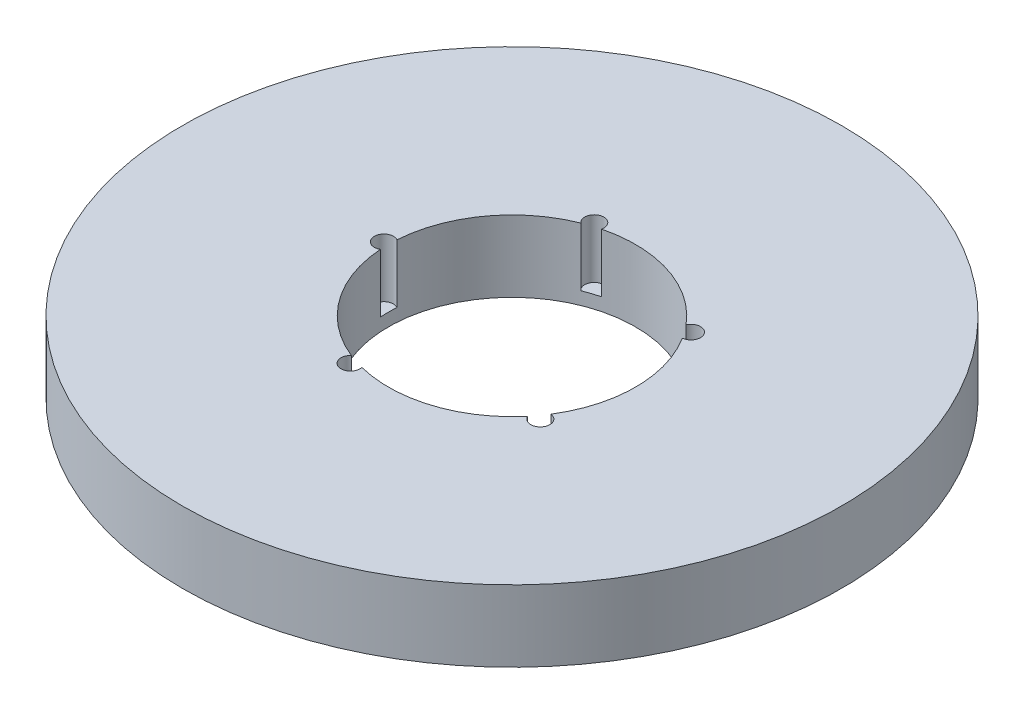
from build123d import *

# Parameters (mm, degrees)
SKETCH1_R           = 60
BOSS_EXTRUDE1_DEPTH = 13
SKETCH2_R           = 22.5
CUT_EXTRUDE1_DEPTH  = 86.842879728
SKETCH3_R           = 1.742539197
CUT_EXTRUDE2_DEPTH  = 10.675480617
CIRPATTERN1_COUNT   = 5


with BuildPart() as part:
    # Sketch1 → Boss-Extrude1 (new body)
    with BuildSketch(Plane(origin=(0, 0, 0), x_dir=(1, 0, 0), z_dir=(0, 1, 0))):
        Circle(SKETCH1_R)
    extrude(amount=BOSS_EXTRUDE1_DEPTH)

    # Sketch2 → Cut-Extrude1 (cut, through all)
    with BuildSketch(Plane(origin=(0, 0, 0), x_dir=(1, 0, 0), z_dir=(0, 1, 0))):
        Circle(SKETCH2_R)
    extrude(amount=CUT_EXTRUDE1_DEPTH, mode=Mode.SUBTRACT)

    # Sketch3 → Cut-Extrude2 (cut)
    with BuildSketch(Plane(origin=(0, 13, 0), x_dir=(1, 0, 0), z_dir=(0, 1, 0))):
        with Locations((-23.328809138, 0)):
            Circle(SKETCH3_R)
    cut_extrude2 = extrude(amount=-CUT_EXTRUDE2_DEPTH, mode=Mode.SUBTRACT)

    # CirPattern1: Cut-Extrude2 ×5 about axis
    cirpattern1_axis = Axis((0, 0, 0), (0, 1, 0))
    for i in range(1, CIRPATTERN1_COUNT):
        add(cut_extrude2.rotate(cirpattern1_axis, i * 360 / CIRPATTERN1_COUNT), mode=Mode.SUBTRACT)


solid = part.part
